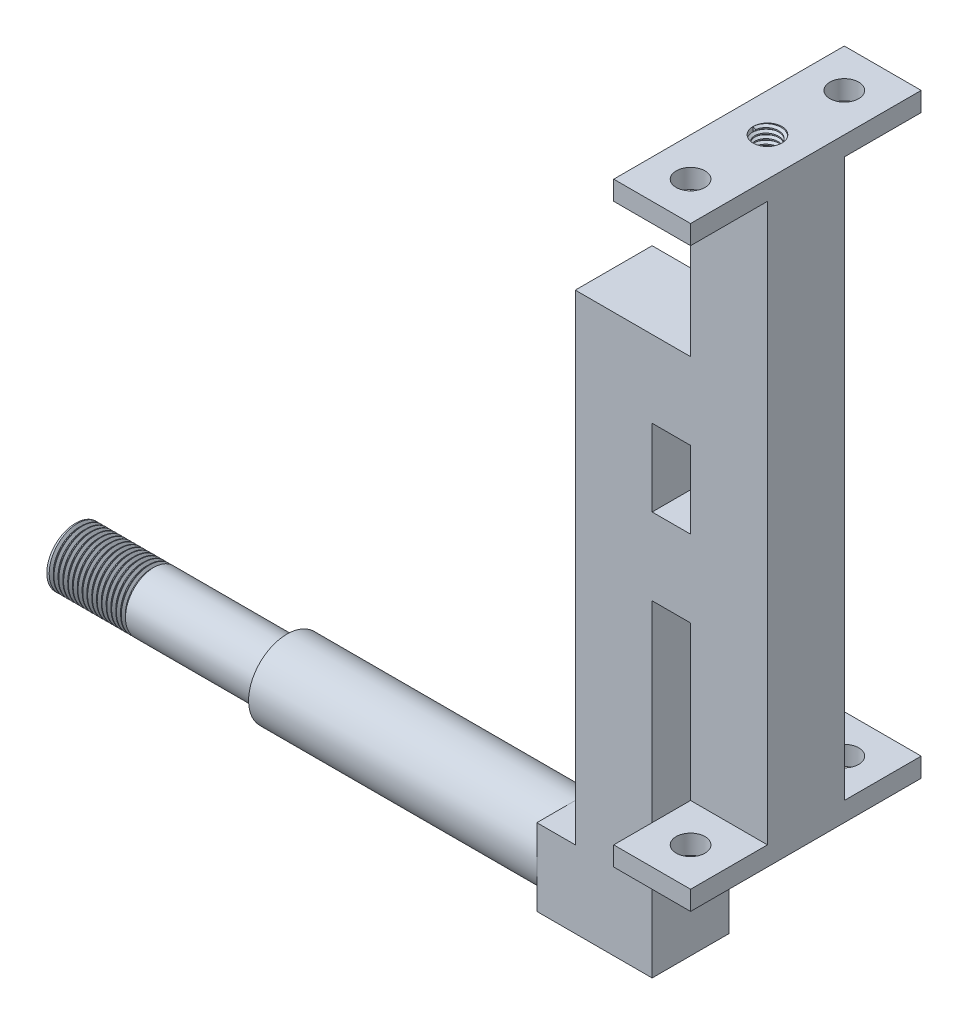
from build123d import *
from build123d.topology import SkipClean

# Parameters (mm, degrees)
SKETCH1_W               = 25.4
SKETCH1_H               = 25.4
SKETCH1_W_2             = 20.32
SKETCH1_H_2             = 20.32
SQ_TB_EXTRUDE_DEPTH     = 196.85
SKETCH3_W               = 20.32
SKETCH3_H               = 20.32
SKETCH3_R               = 4.7625
SKETCH3_W_2             = 25.4
SKETCH3_H_2             = 25.4
END_CAPS_DEPTH          = 6.35
TOP_THREAD_PITCH        = 1.5875
BOTTOM_THREAD_PITCH     = 1.5875
SQ_TB_ANGLES_DEPTH      = 12.7
SQ_TB_ANGLES_DEPTH_BACK = 12.7
WHEEL_THREADS_PITCH     = 1.5875


with BuildPart() as part:
    # Sketch1 → Sq_Tb Extrude (new body)
    with BuildSketch(Plane(origin=(0, 0, 0), x_dir=(1, 0, 0), z_dir=(0, 1, 0))):
        Rectangle(SKETCH1_W, SKETCH1_H)
        Rectangle(SKETCH1_W_2, SKETCH1_H_2, mode=Mode.SUBTRACT)
    extrude(amount=SQ_TB_EXTRUDE_DEPTH)

    # Sketch3 → End Caps (add)
    # profile 1 of 3: a face of its own
    with BuildSketch(Plane(origin=(0, 196.85, 0), x_dir=(1, 0, 0), z_dir=(0, 1, 0))):
        Rectangle(SKETCH3_W, SKETCH3_H)
        with Locations(Location((0, 0, 0), (0, 0, 270))):
            Circle(SKETCH3_R, mode=Mode.SUBTRACT)
    # profile 2 of 3: a face of its own
    with BuildSketch(Plane(origin=(0, 196.85, 0), x_dir=(1, 0, 0), z_dir=(0, 1, 0))):
        with Locations((0, 25.4)):
            Rectangle(SKETCH3_W_2, SKETCH3_H_2)
        with Locations(Location((0, 25.4, 0), (0, 0, 270))):
            Circle(SKETCH3_R, mode=Mode.SUBTRACT)
    # profile 3 of 3: a face of its own
    with BuildSketch(Plane(origin=(0, 196.85, 0), x_dir=(1, 0, 0), z_dir=(0, 1, 0))):
        with Locations((0, -25.4)):
            Rectangle(SKETCH3_W_2, SKETCH3_H_2)
        with Locations(Location((0, -25.4, 0), (0, 0, 90))):
            Circle(SKETCH3_R, mode=Mode.SUBTRACT)
    end_caps = extrude(amount=-END_CAPS_DEPTH)

    # End Cap Mirror: End Caps across plane
    add(end_caps.mirror(Plane.ZX.offset(98.425)))

    # Top Thread: the profile of Thread Profile1 profile screwed along a right-hand helix of 4 turns, 8 arcs to a turn; built about Z, then put on its axis
    with SkipClean():  # the faces are left unmerged after this step: merging them gives an invalid solid
        top_thread_z = Axis((0, 0, 0), (0, 0, 1))
        top_thread_corners = [(4.7628, 0, -0.000173205), (4.7628, 0, 1.389235701), (3.903240423, 0, 0.892968748), (3.903240423, 0, 0.496093748)]
        with BuildLine(mode=Mode.PRIVATE) as top_thread_profile:
            Line(top_thread_corners[0], top_thread_corners[1])
            Line(top_thread_corners[1], top_thread_corners[2])
            Line(top_thread_corners[2], top_thread_corners[3])
            Line(top_thread_corners[3], top_thread_corners[0])
        top_thread_cap = Face(top_thread_profile.wire())
        top_thread_turn_angles = [0, 22.5, 45, 67.5, 90, 112.5, 135, 157.5, 180, 202.5, 225, 247.5, 270, 292.5, 315, 337.5, 360]
        top_thread_turn_weights = [1, 0.9238795325112867, 1, 0.9238795325112867, 1, 0.9238795325112867, 1, 0.9238795325112867, 1, 0.9238795325112867, 1, 0.9238795325112867, 1, 0.9238795325112867, 1, 0.9238795325112867, 1]
        top_thread_turn_rails = [Edge.make_bspline([Vector(p[0], p[1], 0).rotate(top_thread_z, top_thread_turn_angles[k]) / top_thread_turn_weights[k] + Vector(0, 0, p[2] + TOP_THREAD_PITCH * top_thread_turn_angles[k] / 360) for k in range(17)], [0, 0, 0, 1, 1, 2, 2, 3, 3, 4, 4, 5, 5, 6, 6, 7, 7, 8, 8, 8], 2, top_thread_turn_weights) for p in top_thread_corners]
        top_thread_turn_sides = [Face.make_surface_from_curves(top_thread_turn_rails[p[0]], top_thread_turn_rails[p[1]]) for p in [(0, 1), (1, 2), (2, 3), (3, 0)]]
        top_thread = Plane(origin=(0, 196.85, 0), x_dir=(-1, 0, 0), z_dir=(0, -1, 0)) * Solid(Shell([*[p.moved(Location((0, 0, TOP_THREAD_PITCH * i))) for i in range(4) for p in top_thread_turn_sides], top_thread_cap, top_thread_cap.rotate(top_thread_z, 1440).moved(Location((0, 0, TOP_THREAD_PITCH * 1440 / 360)))]))
        add(top_thread)

    # Bottom Thread: the profile of Thread Profile2 profile screwed along a right-hand helix of 4 turns, 8 arcs to a turn; built about Z, then put on its axis
    with SkipClean():  # the faces are left unmerged after this step: merging them gives an invalid solid
        bottom_thread_z = Axis((0, 0, 0), (0, 0, 1))
        bottom_thread_corners = [(4.7628, 0, -0.000173205), (4.7628, 0, 1.389235701), (3.903240423, 0, 0.892968748), (3.903240423, 0, 0.496093748)]
        with BuildLine(mode=Mode.PRIVATE) as bottom_thread_profile:
            Line(bottom_thread_corners[0], bottom_thread_corners[1])
            Line(bottom_thread_corners[1], bottom_thread_corners[2])
            Line(bottom_thread_corners[2], bottom_thread_corners[3])
            Line(bottom_thread_corners[3], bottom_thread_corners[0])
        bottom_thread_cap = Face(bottom_thread_profile.wire())
        bottom_thread_turn_angles = [0, 22.5, 45, 67.5, 90, 112.5, 135, 157.5, 180, 202.5, 225, 247.5, 270, 292.5, 315, 337.5, 360]
        bottom_thread_turn_weights = [1, 0.9238795325112867, 1, 0.9238795325112867, 1, 0.9238795325112867, 1, 0.9238795325112867, 1, 0.9238795325112867, 1, 0.9238795325112867, 1, 0.9238795325112867, 1, 0.9238795325112867, 1]
        bottom_thread_turn_rails = [Edge.make_bspline([Vector(p[0], p[1], 0).rotate(bottom_thread_z, bottom_thread_turn_angles[k]) / bottom_thread_turn_weights[k] + Vector(0, 0, p[2] + BOTTOM_THREAD_PITCH * bottom_thread_turn_angles[k] / 360) for k in range(17)], [0, 0, 0, 1, 1, 2, 2, 3, 3, 4, 4, 5, 5, 6, 6, 7, 7, 8, 8, 8], 2, bottom_thread_turn_weights) for p in bottom_thread_corners]
        bottom_thread_turn_sides = [Face.make_surface_from_curves(bottom_thread_turn_rails[p[0]], bottom_thread_turn_rails[p[1]]) for p in [(0, 1), (1, 2), (2, 3), (3, 0)]]
        bottom_thread = Plane(origin=(0, 0, 0), x_dir=(1, 0, 0), z_dir=(0, 1, 0)) * Solid(Shell([*[p.moved(Location((0, 0, BOTTOM_THREAD_PITCH * i))) for i in range(4) for p in bottom_thread_turn_sides], bottom_thread_cap, bottom_thread_cap.rotate(bottom_thread_z, 1440).moved(Location((0, 0, BOTTOM_THREAD_PITCH * 1440 / 360)))]))
        add(bottom_thread)

    # Sketch9 → Sq_Tb Angles (add, two sides: drawn at the far end of the back side and taken through both)
    with SkipClean():  # the faces are left unmerged after this step: merging them gives an invalid solid
        with BuildSketch(Plane.XY.offset(-SQ_TB_ANGLES_DEPTH_BACK)):
            Polygon((-63.5, -50.8), (-25.4, -50.8), (-25.4, -25.4), (-25.4, 57.15), (-12.7, 57.15), (-12.7, 82.55), (-25.4, 82.55), (-25.4, 107.95), (-12.7, 107.95), (-12.7, 133.35), (-50.8, 133.35), (-50.8, 107.95), (-50.8, -25.4), (-63.1414809, -25.4), (-63.5, -25.4), align=None)
        extrude(amount=SQ_TB_ANGLES_DEPTH + SQ_TB_ANGLES_DEPTH_BACK)

    # Sketch11 → Wheel Rod (revolve)
    with SkipClean():  # the faces are left unmerged after this step: merging them gives an invalid solid
        with BuildSketch(Plane.XY):
            Polygon((-63.5, -38.1), (-228.6, -38.1), (-228.6, -28.575), (-158.75, -28.575), (-158.75, -25.4), (-63.5, -25.4), align=None)
        revolve(axis=Axis((-63.5, -38.1, 0), (-1, 0, 0)))

    # Wheel Threads: the profile of Thread Profile3 profile screwed along a right-hand helix of 16 turns, 8 arcs to a turn; built about Z, then put on its axis
    with SkipClean():  # the faces are left unmerged after this step: merging them gives an invalid solid
        wheel_threads_z = Axis((0, 0, 0), (0, 0, 1))
        wheel_threads_corners = [(9.5253, 0, -0.000173205), (9.5253, 0, 1.389235701), (8.665740423, 0, 0.892968748), (8.665740423, 0, 0.496093748)]
        with BuildLine(mode=Mode.PRIVATE) as wheel_threads_profile:
            Line(wheel_threads_corners[0], wheel_threads_corners[1])
            Line(wheel_threads_corners[1], wheel_threads_corners[2])
            Line(wheel_threads_corners[2], wheel_threads_corners[3])
            Line(wheel_threads_corners[3], wheel_threads_corners[0])
        wheel_threads_cap = Face(wheel_threads_profile.wire())
        wheel_threads_turn_angles = [0, 22.5, 45, 67.5, 90, 112.5, 135, 157.5, 180, 202.5, 225, 247.5, 270, 292.5, 315, 337.5, 360]
        wheel_threads_turn_weights = [1, 0.9238795325112867, 1, 0.9238795325112867, 1, 0.9238795325112867, 1, 0.9238795325112867, 1, 0.9238795325112867, 1, 0.9238795325112867, 1, 0.9238795325112867, 1, 0.9238795325112867, 1]
        wheel_threads_turn_rails = [Edge.make_bspline([Vector(p[0], p[1], 0).rotate(wheel_threads_z, wheel_threads_turn_angles[k]) / wheel_threads_turn_weights[k] + Vector(0, 0, p[2] + WHEEL_THREADS_PITCH * wheel_threads_turn_angles[k] / 360) for k in range(17)], [0, 0, 0, 1, 1, 2, 2, 3, 3, 4, 4, 5, 5, 6, 6, 7, 7, 8, 8, 8], 2, wheel_threads_turn_weights) for p in wheel_threads_corners]
        wheel_threads_turn_sides = [Face.make_surface_from_curves(wheel_threads_turn_rails[p[0]], wheel_threads_turn_rails[p[1]]) for p in [(0, 1), (1, 2), (2, 3), (3, 0)]]
        wheel_threads = Plane(origin=(-228.6, -38.1, 0), x_dir=(0, 0, -1), z_dir=(1, 0, 0)) * Solid(Shell([*[p.moved(Location((0, 0, WHEEL_THREADS_PITCH * i))) for i in range(16) for p in wheel_threads_turn_sides], wheel_threads_cap, wheel_threads_cap.rotate(wheel_threads_z, 5760).moved(Location((0, 0, WHEEL_THREADS_PITCH * 5760 / 360)))]))
        add(wheel_threads, mode=Mode.SUBTRACT)


solid = part.part
